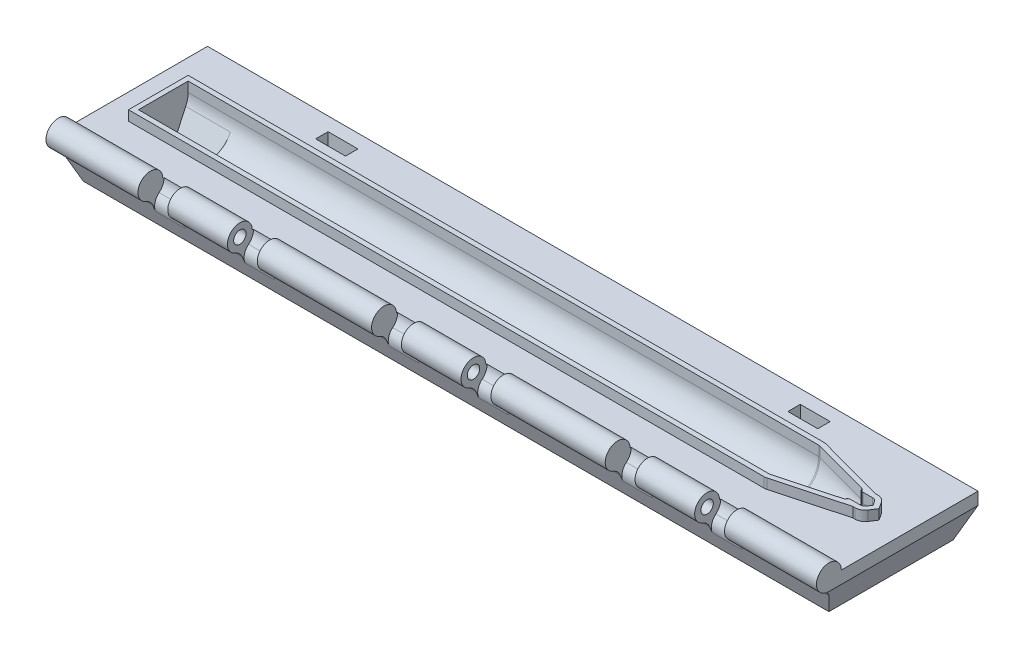
from build123d import *

# Parameters (mm, degrees)
BOSS_EXTRUDE1_START = 1.5
SKETCH1_W           = 155
SKETCH1_H           = 30
BOSS_EXTRUDE1_DEPTH = 8.5
SKETCH2_R           = 2.5
BOSS_EXTRUDE2_DEPTH = 155
CUT_EXTRUDE1_START  = 6
SKETCH3_R           = 2.75
CUT_EXTRUDE1_DEPTH  = 6
CUT_EXTRUDE2_START  = 35
SKETCH3_2_R         = 2.75
CUT_EXTRUDE2_DEPTH  = 6
CUT_EXTRUDE3_START  = 53
SKETCH3_3_R         = 2.75
CUT_EXTRUDE3_DEPTH  = 6
SKETCH4_R           = 1.25
CUT_EXTRUDE4_DEPTH  = 6
CUT_EXTRUDE5_REACH  = 134.26
SKETCH6_R           = 1.25
BOSS_EXTRUDE3_DEPTH = 2
CUT_EXTRUDE6_DEPTH  = 9
CUT_EXTRUDE7_DEPTH  = 157.484823545
FILLET4_R           = 2.5
FILLET5_R           = 2.5
CUT_EXTRUDE8_DEPTH  = 85.96322734
CUT_EXTRUDE9_START  = -44.5
CUT_EXTRUDE9_DEPTH  = 6


with BuildPart() as part:
    # Sketch1 → Boss-Extrude1 (new body)
    with BuildSketch(Plane(origin=(0, 0, 0), x_dir=(1, 0, 0), z_dir=(0, 1, 0)).offset(BOSS_EXTRUDE1_START)):
        Rectangle(SKETCH1_W, SKETCH1_H)
    extrude(amount=BOSS_EXTRUDE1_DEPTH)

    # Sketch2 → Boss-Extrude2 (add, through all)
    with BuildSketch(Plane.ZY.offset(77.5)):
        with Locations((15, 10)):
            Circle(SKETCH2_R)
    extrude(amount=-BOSS_EXTRUDE2_DEPTH)

    # Sketch3 → Cut-Extrude1 (cut)
    with BuildSketch(Plane(origin=(0, 0, 0), x_dir=(0, 0, -1), z_dir=(1, 0, 0)).offset(CUT_EXTRUDE1_START)):
        with Locations((-15, 10)):
            Circle(SKETCH3_R)
    cut_extrude1 = extrude(amount=CUT_EXTRUDE1_DEPTH, mode=Mode.SUBTRACT)

    # Mirror1: Cut-Extrude1 across plane
    add(cut_extrude1.mirror(Plane(origin=(0, 0, 0), x_dir=(0, 0, 1), z_dir=(1, 0, 0))), mode=Mode.SUBTRACT)

    # Sketch3<2> → Cut-Extrude2 (cut)
    with BuildSketch(Plane(origin=(0, 0, 0), x_dir=(0, 0, -1), z_dir=(1, 0, 0)).offset(CUT_EXTRUDE2_START)):
        with Locations((-15, 10)):
            Circle(SKETCH3_2_R)
    cut_extrude2 = extrude(amount=CUT_EXTRUDE2_DEPTH, mode=Mode.SUBTRACT)

    # Sketch3<3> → Cut-Extrude3 (cut)
    with BuildSketch(Plane(origin=(0, 0, 0), x_dir=(0, 0, -1), z_dir=(1, 0, 0)).offset(CUT_EXTRUDE3_START)):
        with Locations((-15, 10)):
            Circle(SKETCH3_3_R)
    cut_extrude3 = extrude(amount=CUT_EXTRUDE3_DEPTH, mode=Mode.SUBTRACT)

    # Mirror2: Cut-Extrude2, Cut-Extrude3 across plane
    add(cut_extrude2.mirror(Plane(origin=(0, 0, 0), x_dir=(0, 0, 1), z_dir=(1, 0, 0))), mode=Mode.SUBTRACT)
    add(cut_extrude3.mirror(Plane(origin=(0, 0, 0), x_dir=(0, 0, 1), z_dir=(1, 0, 0))), mode=Mode.SUBTRACT)

    # Sketch4 → Cut-Extrude4 (cut, symmetric)
    with BuildSketch(Plane(origin=(0, 0, 0), x_dir=(0, 0, -1), z_dir=(1, 0, 0))):
        with Locations((-15, 10)):
            Circle(SKETCH4_R)
    extrude(amount=CUT_EXTRUDE4_DEPTH, both=True, mode=Mode.SUBTRACT)

    # Sketch6 → Cut-Extrude5 (cut, up to next)
    with BuildSketch(Plane(origin=(53, 0, 0), x_dir=(0, 0, -1), z_dir=(1, 0, 0)), mode=Mode.PRIVATE) as cut_extrude5_sk1:
        with Locations((-15, 10)):
            Circle(SKETCH6_R)
    cut_extrude5_tool1 = extrude(cut_extrude5_sk1.sketch, amount=-CUT_EXTRUDE5_REACH, mode=Mode.PRIVATE) & part.part
    cut_extrude5 = cut_extrude5_tool1.solids().sort_by_distance((53, 10, 15))[0]
    add(cut_extrude5, mode=Mode.SUBTRACT)

    # Mirror3: Cut-Extrude5 across plane
    add(cut_extrude5.mirror(Plane(origin=(0, 0, 0), x_dir=(0, 0, 1), z_dir=(1, 0, 0))), mode=Mode.SUBTRACT)

    # Sketch7 → Cut-Revolve1 (revolve, cut)
    with BuildSketch(Plane(origin=(0, 10, 0), x_dir=(1, 0, 0), z_dir=(0, 1, 0))):
        with BuildLine():
            Line((-71.4, 0), (-71.4, -5))
            Line((-71.4, -5), (55.466979459, -5))
            ThreePointArc((55.466979459, -5), (55.598838528, -4.991268473), (55.728394934, -4.965226372))
            Line((55.728394934, -4.965226372), (67.230707738, -1.850016654))
            ThreePointArc((67.230707738, -1.850016654), (67.497085551, -1.671250577), (67.6, -1.367403468))
            Line((67.6, -1.367403468), (67.6, -1.75))
            ThreePointArc((67.6, -1.75), (67.746446609, -1.396446609), (68.1, -1.25))
            Line((68.1, -1.25), (70.052734234, -1.25))
            ThreePointArc((70.052734234, -1.25), (70.532810427, -1.127226794), (70.895005634, -0.789053696))
            Line((70.895005634, -0.789053696), (71.4, 0))
            Line((71.4, 0), (-71.4, 0))
        make_face()
    revolve(axis=Axis((-71.4, 10, 0), (1, 0, 0)), mode=Mode.SUBTRACT)

    # Sketch13 → Boss-Extrude3 (add)
    with BuildSketch(Plane(origin=(0, 10, 0), x_dir=(1, 0, 0), z_dir=(0, 1, 0))):
        with BuildLine():
            Line((69.579174387, 2.25), (55.98981041, 5.930452744))
            ThreePointArc((55.98981041, 5.930452744), (55.730697596, 5.982536946), (55.466979459, 6))
            Line((55.466979459, 6), (-72.4, 6))
            Line((-72.4, 6), (-72.4, -6))
            Line((-72.4, -6), (55.466979459, -6))
            ThreePointArc((55.466979459, -6), (55.730697596, -5.982536946), (55.98981041, -5.930452744))
            Line((55.98981041, -5.930452744), (69.579174387, -2.25))
            Line((69.579174387, -2.25), (70.052734234, -2.25))
            ThreePointArc((70.052734234, -2.25), (71.012886621, -2.004453588), (71.737277035, -1.328107393))
            Line((71.737277035, -1.328107393), (72.587265766, 0))
            Line((72.587265766, 0), (71.737277035, 1.328107393))
            ThreePointArc((71.737277035, 1.328107393), (71.012886621, 2.004453588), (70.052734234, 2.25))
            Line((70.052734234, 2.25), (69.579174387, 2.25))
        make_face()
        with BuildLine():
            Line((-71.4, 5), (-71.4, -5))
            Line((-71.4, -5), (55.466979459, -5))
            ThreePointArc((55.466979459, -5), (55.598838528, -4.991268473), (55.728394934, -4.965226372))
            Line((55.728394934, -4.965226372), (67.230707738, -1.850016654))
            ThreePointArc((67.230707738, -1.850016654), (67.497085551, -1.671250577), (67.6, -1.367403468))
            Line((67.6, -1.367403468), (67.6, -1.75))
            ThreePointArc((67.6, -1.75), (67.746446609, -1.396446609), (68.1, -1.25))
            Line((68.1, -1.25), (70.052734234, -1.25))
            ThreePointArc((70.052734234, -1.25), (70.532810427, -1.127226794), (70.895005634, -0.789053696))
            Line((70.895005634, -0.789053696), (71.4, 0))
            Line((71.4, 0), (70.895005634, 0.789053696))
            ThreePointArc((70.895005634, 0.789053696), (70.532810427, 1.127226794), (70.052734234, 1.25))
            Line((70.052734234, 1.25), (68.1, 1.25))
            ThreePointArc((68.1, 1.25), (67.746446609, 1.396446609), (67.6, 1.75))
            Line((67.6, 1.75), (67.6, 1.367403468))
            ThreePointArc((67.6, 1.367403468), (67.497085551, 1.671250577), (67.230707738, 1.850016654))
            Line((67.230707738, 1.850016654), (55.728394934, 4.965226372))
            ThreePointArc((55.728394934, 4.965226372), (55.598838528, 4.991268473), (55.466979459, 5))
            Line((55.466979459, 5), (-71.4, 5))
        make_face(mode=Mode.SUBTRACT)
    extrude(amount=BOSS_EXTRUDE3_DEPTH)

    # Sketch9 → Cut-Extrude6 (cut)
    with BuildSketch(Plane(origin=(-71.4, 0, 0), x_dir=(0, 0, -1), z_dir=(1, 0, 0))):
        Polygon((-1.701522254, 3), (-4.468435287, 7.756545947), (4.584879724, 8.005287511), (2.298477746, 3), align=None)
    extrude(amount=CUT_EXTRUDE6_DEPTH, mode=Mode.SUBTRACT)

    # Sketch10 → Cut-Extrude7 (cut, through all)
    with BuildSketch(Plane.ZY.offset(77.5)):
        Polygon((15, 7.5), (12.5, 1.5), (15, 1.5), align=None)
        Polygon((-15, 7.5), (-12.5, 1.5), (-15, 1.5), align=None)
    extrude(amount=-CUT_EXTRUDE7_DEPTH, mode=Mode.SUBTRACT)

    # Fillet4
    # the kernel refuses this fillet: 2.5 mm, written as the material it adds along each edge
    with BuildSketch(Plane(origin=(77.5, 7.5, 15), x_dir=(0, -0.9230769230769229, -0.3846153846153851), z_dir=(-1, 0, 0))) as fillet4_piece_1_section:
        with BuildLine():
            CenterArc((1.300319815, 2.5), FILLET4_R, 223.81306146, 46.18693854)
            ThreePointArc((-0.503686246, 0.769230769), (-0.216174948, 0.407970624), (0, 0))
            Line((0, 0), (1.300319815, 0))
        make_face()
    fillet4_piece_1 = extrude(amount=18.5, mode=Mode.PRIVATE)
    fillet4_piece_1 = fillet4_piece_1 - Plane(origin=(68.25, 10, 15), x_dir=(0, 0, -1), z_dir=(-1, 0, 0)) * Cylinder(2.75, 43, mode=Mode.PRIVATE)
    add(fillet4_piece_1)
    with BuildSketch(Plane(origin=(77.5, 7.5, 15), x_dir=(0, -0.9230769230769229, -0.3846153846153851), z_dir=(-1, 0, 0))) as fillet4_piece_2_section:
        with BuildLine():
            CenterArc((1.300319815, 2.5), FILLET4_R, 223.81306146, 46.18693854)
            ThreePointArc((-0.503686246, 0.769230769), (-0.216174948, 0.407970624), (0, 0))
            Line((0, 0), (1.300319815, 0))
        make_face()
    fillet4_piece_2 = extrude(amount=18.5, mode=Mode.PRIVATE)
    fillet4_piece_2 = fillet4_piece_2 & Plane(origin=(68.25, 10, 15), x_dir=(0, 0, -1), z_dir=(-1, 0, 0)) * Cylinder(2.75, 43, mode=Mode.PRIVATE)
    add(fillet4_piece_2)
    with BuildSketch(Plane(origin=(77.5, 7.5, 15), x_dir=(0, -0.9230769230769229, -0.3846153846153851), z_dir=(-1, 0, 0))) as fillet4_piece_3_section:
        with BuildLine():
            CenterArc((1.300319815, 2.5), FILLET4_R, 223.81306146, 46.18693854)
            ThreePointArc((-0.503686246, 0.769230769), (-0.216174948, 0.407970624), (0, 0))
            Line((0, 0), (1.300319815, 0))
        make_face()
    fillet4_piece_3 = extrude(amount=21.750799538, mode=Mode.PRIVATE)
    fillet4_piece_3 = split(fillet4_piece_3, bisect_by=Plane(origin=(59, 6.935167345, 14.810535734), z_dir=(-1, 0, 0)), keep=Keep.TOP, mode=Mode.PRIVATE)
    fillet4_piece_3 = fillet4_piece_3 - Plane(origin=(57.374600231, 10, 15), x_dir=(0, 0, -1), z_dir=(-1, 0, 0)) * Cylinder(2.75, 49, mode=Mode.PRIVATE)
    add(fillet4_piece_3)
    with BuildSketch(Plane(origin=(9.250799538, 7.5, 15), x_dir=(0, -0.923076923076923, -0.3846153846153848), z_dir=(-1, 0, 0))) as fillet4_piece_4_section:
        with BuildLine():
            CenterArc((1.300319815, 2.5), FILLET4_R, 223.81306146, 46.18693854)
            ThreePointArc((-0.503686246, 0.769230769), (-0.216174948, 0.407970624), (0, 0))
            Line((0, 0), (1.300319815, 0))
        make_face()
    fillet4_piece_4 = extrude(amount=15.250799538, mode=Mode.PRIVATE)
    fillet4_piece_4 = fillet4_piece_4 - Plane(origin=(7.625399769, 10, 15), x_dir=(0, 0, -1), z_dir=(-1, 0, 0)) * Cylinder(2.75, 36, mode=Mode.PRIVATE)
    fillet4_piece_4 = split(fillet4_piece_4, bisect_by=Plane(origin=(6, 6.935167345, 14.810535734), z_dir=(1, 0, 0)), keep=Keep.TOP, mode=Mode.PRIVATE)
    add(fillet4_piece_4)
    with BuildSketch(Plane(origin=(6, 7.5, 15), x_dir=(0, -0.9230769230769229, -0.3846153846153851), z_dir=(-1, 0, 0))) as fillet4_piece_5_section:
        with BuildLine():
            CenterArc((1.300319815, 2.5), FILLET4_R, 223.81306146, 46.18693854)
            ThreePointArc((-0.503686246, 0.769230769), (-0.216174948, 0.407970624), (0, 0))
            Line((0, 0), (1.300319815, 0))
        make_face()
    fillet4_piece_5 = extrude(amount=12, mode=Mode.PRIVATE)
    fillet4_piece_5 = fillet4_piece_5 - Plane(origin=(0, 10, 15), x_dir=(0, 0, -1), z_dir=(-1, 0, 0)) * Cylinder(2.75, 30, mode=Mode.PRIVATE)
    add(fillet4_piece_5)
    with BuildSketch(Plane(origin=(6, 7.5, 15), x_dir=(0, -0.9230769230769229, -0.3846153846153851), z_dir=(-1, 0, 0))) as fillet4_piece_6_section:
        with BuildLine():
            CenterArc((1.300319815, 2.5), FILLET4_R, 223.81306146, 46.18693854)
            ThreePointArc((-0.503686246, 0.769230769), (-0.216174948, 0.407970624), (0, 0))
            Line((0, 0), (1.300319815, 0))
        make_face()
    fillet4_piece_6 = extrude(amount=12, mode=Mode.PRIVATE)
    fillet4_piece_6 = fillet4_piece_6 & Plane(origin=(0, 10, 15), x_dir=(0, 0, -1), z_dir=(-1, 0, 0)) * Cylinder(2.75, 30, mode=Mode.PRIVATE)
    add(fillet4_piece_6)
    with BuildSketch(Plane(origin=(6, 7.5, 15), x_dir=(0, -0.9230769230769229, -0.3846153846153851), z_dir=(-1, 0, 0))) as fillet4_piece_7_section:
        with BuildLine():
            CenterArc((1.300319815, 2.5), FILLET4_R, 223.81306146, 46.18693854)
            ThreePointArc((-0.503686246, 0.769230769), (-0.216174948, 0.407970624), (0, 0))
            Line((0, 0), (1.300319815, 0))
        make_face()
    fillet4_piece_7 = extrude(amount=15.250799538, mode=Mode.PRIVATE)
    fillet4_piece_7 = fillet4_piece_7 - Plane(origin=(-7.625399769, 10, 15), x_dir=(0, 0, -1), z_dir=(-1, 0, 0)) * Cylinder(2.75, 36, mode=Mode.PRIVATE)
    fillet4_piece_7 = split(fillet4_piece_7, bisect_by=Plane(origin=(-6, 6.935167345, 14.810535734), z_dir=(-1, 0, 0)), keep=Keep.TOP, mode=Mode.PRIVATE)
    add(fillet4_piece_7)
    with BuildSketch(Plane(origin=(-8.749200462, 7.5, 15), x_dir=(0, -0.9230769230769229, -0.3846153846153851), z_dir=(-1, 0, 0))) as fillet4_piece_8_section:
        with BuildLine():
            CenterArc((1.300319815, 2.5), FILLET4_R, 223.81306146, 46.18693854)
            ThreePointArc((-0.503686246, 0.769230769), (-0.216174948, 0.407970624), (0, 0))
            Line((0, 0), (1.300319815, 0))
        make_face()
    fillet4_piece_8 = extrude(amount=26.250799538, mode=Mode.PRIVATE)
    fillet4_piece_8 = fillet4_piece_8 - Plane(origin=(-10.374600231, 10, 15), x_dir=(0, 0, -1), z_dir=(1, 0, 0)) * Cylinder(2.75, 58, mode=Mode.PRIVATE)
    fillet4_piece_8 = split(fillet4_piece_8, bisect_by=Plane(origin=(-12, 6.935167345, 14.810535734), z_dir=(1, 0, 0)), keep=Keep.TOP, mode=Mode.PRIVATE)
    add(fillet4_piece_8)
    with BuildSketch(Plane(origin=(-12, 7.5, 15), x_dir=(0, -0.9230769230769229, -0.3846153846153851), z_dir=(-1, 0, 0))) as fillet4_piece_9_section:
        with BuildLine():
            CenterArc((1.300319815, 2.5), FILLET4_R, 223.81306146, 46.18693854)
            ThreePointArc((-0.503686246, 0.769230769), (-0.216174948, 0.407970624), (0, 0))
            Line((0, 0), (1.300319815, 0))
        make_face()
    fillet4_piece_9 = extrude(amount=23, mode=Mode.PRIVATE)
    fillet4_piece_9 = fillet4_piece_9 - Plane(origin=(-23.5, 10, 15), x_dir=(0, 0, -1), z_dir=(1, 0, 0)) * Cylinder(2.75, 52, mode=Mode.PRIVATE)
    add(fillet4_piece_9)
    with BuildSketch(Plane(origin=(-12, 7.5, 15), x_dir=(0, -0.9230769230769229, -0.3846153846153851), z_dir=(-1, 0, 0))) as fillet4_piece_10_section:
        with BuildLine():
            CenterArc((1.300319815, 2.5), FILLET4_R, 223.81306146, 46.18693854)
            ThreePointArc((-0.503686246, 0.769230769), (-0.216174948, 0.407970624), (0, 0))
            Line((0, 0), (1.300319815, 0))
        make_face()
    fillet4_piece_10 = extrude(amount=23, mode=Mode.PRIVATE)
    fillet4_piece_10 = fillet4_piece_10 & Plane(origin=(-23.5, 10, 15), x_dir=(0, 0, -1), z_dir=(1, 0, 0)) * Cylinder(2.75, 52, mode=Mode.PRIVATE)
    add(fillet4_piece_10)
    with BuildSketch(Plane(origin=(-12, 7.5, 15), x_dir=(0, -0.9230769230769229, -0.3846153846153851), z_dir=(-1, 0, 0))) as fillet4_piece_11_section:
        with BuildLine():
            CenterArc((1.300319815, 2.5), FILLET4_R, 223.81306146, 46.18693854)
            ThreePointArc((-0.503686246, 0.769230769), (-0.216174948, 0.407970624), (0, 0))
            Line((0, 0), (1.300319815, 0))
        make_face()
    fillet4_piece_11 = extrude(amount=26.250799538, mode=Mode.PRIVATE)
    fillet4_piece_11 = fillet4_piece_11 - Plane(origin=(-36.625399769, 10, 15), x_dir=(0, 0, -1), z_dir=(1, 0, 0)) * Cylinder(2.75, 58, mode=Mode.PRIVATE)
    fillet4_piece_11 = split(fillet4_piece_11, bisect_by=Plane(origin=(-35, 6.935167345, 14.810535734), z_dir=(-1, 0, 0)), keep=Keep.TOP, mode=Mode.PRIVATE)
    add(fillet4_piece_11)
    with BuildSketch(Plane(origin=(38.250799538, 7.5, 15), x_dir=(0, -0.9230769230769229, -0.3846153846153851), z_dir=(-1, 0, 0))) as fillet4_piece_12_section:
        with BuildLine():
            CenterArc((1.300319815, 2.5), FILLET4_R, 223.81306146, 46.18693854)
            ThreePointArc((-0.503686246, 0.769230769), (-0.216174948, 0.407970624), (0, 0))
            Line((0, 0), (1.300319815, 0))
        make_face()
    fillet4_piece_12 = extrude(amount=26.250799538, mode=Mode.PRIVATE)
    fillet4_piece_12 = fillet4_piece_12 - Plane(origin=(36.625399769, 10, 15), x_dir=(0, 0, -1), z_dir=(-1, 0, 0)) * Cylinder(2.75, 58, mode=Mode.PRIVATE)
    fillet4_piece_12 = split(fillet4_piece_12, bisect_by=Plane(origin=(35, 6.935167345, 14.810535734), z_dir=(1, 0, 0)), keep=Keep.TOP, mode=Mode.PRIVATE)
    add(fillet4_piece_12)
    with BuildSketch(Plane(origin=(35, 7.5, 15), x_dir=(0, -0.9230769230769229, -0.3846153846153851), z_dir=(-1, 0, 0))) as fillet4_piece_13_section:
        with BuildLine():
            CenterArc((1.300319815, 2.5), FILLET4_R, 223.81306146, 46.18693854)
            ThreePointArc((-0.503686246, 0.769230769), (-0.216174948, 0.407970624), (0, 0))
            Line((0, 0), (1.300319815, 0))
        make_face()
    fillet4_piece_13 = extrude(amount=23, mode=Mode.PRIVATE)
    fillet4_piece_13 = fillet4_piece_13 - Plane(origin=(23.5, 10, 15), x_dir=(0, 0, -1), z_dir=(-1, 0, 0)) * Cylinder(2.75, 52, mode=Mode.PRIVATE)
    add(fillet4_piece_13)
    with BuildSketch(Plane(origin=(35, 7.5, 15), x_dir=(0, -0.9230769230769229, -0.3846153846153851), z_dir=(-1, 0, 0))) as fillet4_piece_14_section:
        with BuildLine():
            CenterArc((1.300319815, 2.5), FILLET4_R, 223.81306146, 46.18693854)
            ThreePointArc((-0.503686246, 0.769230769), (-0.216174948, 0.407970624), (0, 0))
            Line((0, 0), (1.300319815, 0))
        make_face()
    fillet4_piece_14 = extrude(amount=23, mode=Mode.PRIVATE)
    fillet4_piece_14 = fillet4_piece_14 & Plane(origin=(23.5, 10, 15), x_dir=(0, 0, -1), z_dir=(-1, 0, 0)) * Cylinder(2.75, 52, mode=Mode.PRIVATE)
    add(fillet4_piece_14)
    with BuildSketch(Plane(origin=(35, 7.5, 15), x_dir=(0, -0.9230769230769229, -0.3846153846153851), z_dir=(-1, 0, 0))) as fillet4_piece_15_section:
        with BuildLine():
            CenterArc((1.300319815, 2.5), FILLET4_R, 223.81306146, 46.18693854)
            ThreePointArc((-0.503686246, 0.769230769), (-0.216174948, 0.407970624), (0, 0))
            Line((0, 0), (1.300319815, 0))
        make_face()
    fillet4_piece_15 = extrude(amount=26.250799538, mode=Mode.PRIVATE)
    fillet4_piece_15 = fillet4_piece_15 - Plane(origin=(10.374600231, 10, 15), x_dir=(0, 0, -1), z_dir=(-1, 0, 0)) * Cylinder(2.75, 58, mode=Mode.PRIVATE)
    fillet4_piece_15 = split(fillet4_piece_15, bisect_by=Plane(origin=(12, 6.935167345, 14.810535734), z_dir=(-1, 0, 0)), keep=Keep.TOP, mode=Mode.PRIVATE)
    add(fillet4_piece_15)
    with BuildSketch(Plane(origin=(56.250799538, 7.5, 15), x_dir=(0, -0.9230769230769229, -0.3846153846153851), z_dir=(-1, 0, 0))) as fillet4_piece_16_section:
        with BuildLine():
            CenterArc((1.300319815, 2.5), FILLET4_R, 223.81306146, 46.18693854)
            ThreePointArc((-0.503686246, 0.769230769), (-0.216174948, 0.407970624), (0, 0))
            Line((0, 0), (1.300319815, 0))
        make_face()
    fillet4_piece_16 = extrude(amount=15.250799538, mode=Mode.PRIVATE)
    fillet4_piece_16 = fillet4_piece_16 - Plane(origin=(54.625399769, 10, 15), x_dir=(0, 0, -1), z_dir=(-1, 0, 0)) * Cylinder(2.75, 36, mode=Mode.PRIVATE)
    fillet4_piece_16 = split(fillet4_piece_16, bisect_by=Plane(origin=(53, 6.935167345, 14.810535734), z_dir=(1, 0, 0)), keep=Keep.TOP, mode=Mode.PRIVATE)
    add(fillet4_piece_16)
    with BuildSketch(Plane(origin=(53, 7.5, 15), x_dir=(0, -0.9230769230769229, -0.3846153846153851), z_dir=(-1, 0, 0))) as fillet4_piece_17_section:
        with BuildLine():
            CenterArc((1.300319815, 2.5), FILLET4_R, 223.81306146, 46.18693854)
            ThreePointArc((-0.503686246, 0.769230769), (-0.216174948, 0.407970624), (0, 0))
            Line((0, 0), (1.300319815, 0))
        make_face()
    fillet4_piece_17 = extrude(amount=12, mode=Mode.PRIVATE)
    fillet4_piece_17 = fillet4_piece_17 - Plane(origin=(47, 10, 15), x_dir=(0, 0, -1), z_dir=(-1, 0, 0)) * Cylinder(2.75, 30, mode=Mode.PRIVATE)
    add(fillet4_piece_17)
    with BuildSketch(Plane(origin=(53, 7.5, 15), x_dir=(0, -0.9230769230769229, -0.3846153846153851), z_dir=(-1, 0, 0))) as fillet4_piece_18_section:
        with BuildLine():
            CenterArc((1.300319815, 2.5), FILLET4_R, 223.81306146, 46.18693854)
            ThreePointArc((-0.503686246, 0.769230769), (-0.216174948, 0.407970624), (0, 0))
            Line((0, 0), (1.300319815, 0))
        make_face()
    fillet4_piece_18 = extrude(amount=12, mode=Mode.PRIVATE)
    fillet4_piece_18 = fillet4_piece_18 & Plane(origin=(47, 10, 15), x_dir=(0, 0, -1), z_dir=(-1, 0, 0)) * Cylinder(2.75, 30, mode=Mode.PRIVATE)
    add(fillet4_piece_18)
    with BuildSketch(Plane(origin=(53, 7.5, 15), x_dir=(0, -0.9230769230769229, -0.3846153846153851), z_dir=(-1, 0, 0))) as fillet4_piece_19_section:
        with BuildLine():
            CenterArc((1.300319815, 2.5), FILLET4_R, 223.81306146, 46.18693854)
            ThreePointArc((-0.503686246, 0.769230769), (-0.216174948, 0.407970624), (0, 0))
            Line((0, 0), (1.300319815, 0))
        make_face()
    fillet4_piece_19 = extrude(amount=15.250799538, mode=Mode.PRIVATE)
    fillet4_piece_19 = fillet4_piece_19 - Plane(origin=(39.374600231, 10, 15), x_dir=(0, 0, -1), z_dir=(-1, 0, 0)) * Cylinder(2.75, 36, mode=Mode.PRIVATE)
    fillet4_piece_19 = split(fillet4_piece_19, bisect_by=Plane(origin=(41, 6.935167345, 14.810535734), z_dir=(-1, 0, 0)), keep=Keep.TOP, mode=Mode.PRIVATE)
    add(fillet4_piece_19)
    with BuildSketch(Plane(origin=(-37.749200462, 7.5, 15), x_dir=(0, -0.9230769230769229, -0.3846153846153851), z_dir=(-1, 0, 0))) as fillet4_piece_20_section:
        with BuildLine():
            CenterArc((1.300319815, 2.5), FILLET4_R, 223.81306146, 46.18693854)
            ThreePointArc((-0.503686246, 0.769230769), (-0.216174948, 0.407970624), (0, 0))
            Line((0, 0), (1.300319815, 0))
        make_face()
    fillet4_piece_20 = extrude(amount=15.250799538, mode=Mode.PRIVATE)
    fillet4_piece_20 = fillet4_piece_20 - Plane(origin=(-39.374600231, 10, 15), x_dir=(0, 0, -1), z_dir=(1, 0, 0)) * Cylinder(2.75, 36, mode=Mode.PRIVATE)
    fillet4_piece_20 = split(fillet4_piece_20, bisect_by=Plane(origin=(-41, 6.935167345, 14.810535734), z_dir=(1, 0, 0)), keep=Keep.TOP, mode=Mode.PRIVATE)
    add(fillet4_piece_20)
    with BuildSketch(Plane(origin=(-41, 7.5, 15), x_dir=(0, -0.9230769230769229, -0.3846153846153851), z_dir=(-1, 0, 0))) as fillet4_piece_21_section:
        with BuildLine():
            CenterArc((1.300319815, 2.5), FILLET4_R, 223.81306146, 46.18693854)
            ThreePointArc((-0.503686246, 0.769230769), (-0.216174948, 0.407970624), (0, 0))
            Line((0, 0), (1.300319815, 0))
        make_face()
    fillet4_piece_21 = extrude(amount=12, mode=Mode.PRIVATE)
    fillet4_piece_21 = fillet4_piece_21 - Plane(origin=(-47, 10, 15), x_dir=(0, 0, -1), z_dir=(1, 0, 0)) * Cylinder(2.75, 30, mode=Mode.PRIVATE)
    add(fillet4_piece_21)
    with BuildSketch(Plane(origin=(-41, 7.5, 15), x_dir=(0, -0.9230769230769229, -0.3846153846153851), z_dir=(-1, 0, 0))) as fillet4_piece_22_section:
        with BuildLine():
            CenterArc((1.300319815, 2.5), FILLET4_R, 223.81306146, 46.18693854)
            ThreePointArc((-0.503686246, 0.769230769), (-0.216174948, 0.407970624), (0, 0))
            Line((0, 0), (1.300319815, 0))
        make_face()
    fillet4_piece_22 = extrude(amount=12, mode=Mode.PRIVATE)
    fillet4_piece_22 = fillet4_piece_22 & Plane(origin=(-47, 10, 15), x_dir=(0, 0, -1), z_dir=(1, 0, 0)) * Cylinder(2.75, 30, mode=Mode.PRIVATE)
    add(fillet4_piece_22)
    with BuildSketch(Plane(origin=(-41, 7.5, 15), x_dir=(0, -0.9230769230769229, -0.3846153846153851), z_dir=(-1, 0, 0))) as fillet4_piece_23_section:
        with BuildLine():
            CenterArc((1.300319815, 2.5), FILLET4_R, 223.81306146, 46.18693854)
            ThreePointArc((-0.503686246, 0.769230769), (-0.216174948, 0.407970624), (0, 0))
            Line((0, 0), (1.300319815, 0))
        make_face()
    fillet4_piece_23 = extrude(amount=15.250799538, mode=Mode.PRIVATE)
    fillet4_piece_23 = fillet4_piece_23 - Plane(origin=(-54.625399769, 10, 15), x_dir=(0, 0, -1), z_dir=(1, 0, 0)) * Cylinder(2.75, 36, mode=Mode.PRIVATE)
    fillet4_piece_23 = split(fillet4_piece_23, bisect_by=Plane(origin=(-53, 6.935167345, 14.810535734), z_dir=(-1, 0, 0)), keep=Keep.TOP, mode=Mode.PRIVATE)
    add(fillet4_piece_23)
    with BuildSketch(Plane(origin=(-55.749200462, 7.5, 15), x_dir=(0, 0.1838929918147279, 0.9829462689086461), z_dir=(-1, 0, 0))) as fillet4_piece_24_section:
        with BuildLine():
            CenterArc((1.379197439, -2.457365672), FILLET4_R, 100.596598256, 46.18693854)
            Line((-0.712319921, -1.087856586), (0, 0))
            ThreePointArc((0, 0), (0.45973248, -0.042634328), (0.919464959, 0))
        make_face()
    fillet4_piece_24 = extrude(amount=21.750799538, mode=Mode.PRIVATE)
    fillet4_piece_24 = split(fillet4_piece_24, bisect_by=Plane(origin=(-59, 6.935167345, 14.810535734), z_dir=(1, 0, 0)), keep=Keep.TOP, mode=Mode.PRIVATE)
    fillet4_piece_24 = fillet4_piece_24 - Plane(origin=(-57.374600231, 10, 15), x_dir=(0, 0, -1), z_dir=(1, 0, 0)) * Cylinder(2.75, 48, mode=Mode.PRIVATE)
    add(fillet4_piece_24)
    with BuildSketch(Plane(origin=(-59, 7.5, 15), x_dir=(0, 0.1838929918147279, 0.9829462689086461), z_dir=(-1, 0, 0))) as fillet4_piece_25_section:
        with BuildLine():
            CenterArc((1.379197439, -2.457365672), FILLET4_R, 100.596598256, 46.18693854)
            Line((-0.712319921, -1.087856586), (0, 0))
            ThreePointArc((0, 0), (0.45973248, -0.042634328), (0.919464959, 0))
        make_face()
    fillet4_piece_25 = extrude(amount=18.5, mode=Mode.PRIVATE)
    fillet4_piece_25 = fillet4_piece_25 & Plane(origin=(-68.25, 10, 15), x_dir=(0, 0, -1), z_dir=(1, 0, 0)) * Cylinder(2.75, 42, mode=Mode.PRIVATE)
    add(fillet4_piece_25)
    with BuildSketch(Plane(origin=(-59, 7.5, 15), x_dir=(0, 0.1838929918147279, 0.9829462689086461), z_dir=(-1, 0, 0))) as fillet4_piece_26_section:
        with BuildLine():
            CenterArc((1.379197439, -2.457365672), FILLET4_R, 100.596598256, 46.18693854)
            Line((-0.712319921, -1.087856586), (0, 0))
            ThreePointArc((0, 0), (0.45973248, -0.042634328), (0.919464959, 0))
        make_face()
    fillet4_piece_26 = extrude(amount=18.5, mode=Mode.PRIVATE)
    fillet4_piece_26 = fillet4_piece_26 - Plane(origin=(-68.25, 10, 15), x_dir=(0, 0, -1), z_dir=(1, 0, 0)) * Cylinder(2.75, 42, mode=Mode.PRIVATE)
    add(fillet4_piece_26)

    # Fillet5
    # the kernel refuses this fillet: 2.5 mm, written as the material it takes off along each edge
    with BuildSketch(Plane(origin=(-53, 7.257719675, 15.205909246), x_dir=(-1.5067847273280937e-15, -0.8753317505424749, -0.48352282933926355), z_dir=(-1, 0, 0)), Plane(origin=(-35, 7.257719675, 15.205909246), x_dir=(0, -0.8753317505424749, -0.4835228293392634), z_dir=(-1, 0, 0)), Plane(origin=(-6, 7.257719675, 15.205909246), x_dir=(0, -0.8753317505424749, -0.4835228293392634), z_dir=(-1, 0, 0)), Plane(origin=(12, 7.257719675, 15.205909246), x_dir=(-1.2204816990271069e-15, -0.8753317505424749, -0.48352282933926355), z_dir=(-1, 0, 0)), Plane(origin=(41, 7.257719675, 15.205909246), x_dir=(-1.2204816990271069e-15, -0.8753317505424749, -0.48352282933926355), z_dir=(-1, 0, 0)), Plane(origin=(59, 7.257719675, 15.205909246), x_dir=(0, -0.8753317505424744, -0.48352282933926427), z_dir=(-1, 0, 0))) as fillet5_piece_1:
        with BuildLine():
            CenterArc((2.857120655, -2.484922145), FILLET5_R, 96.295872515, 72.959938099)
            Line((0.400947383, -2.018861144), (0.155330056, -1.972255043))
            ThreePointArc((0.155330056, -1.972255043), (0.151266072, -1.019203243), (-0.209167565, -0.136926731))
            Line((-0.209167565, -0.136926731), (0.090580679, 0.233013177))
            ThreePointArc((0.090580679, 0.233013177), (1.152547885, 0.093701837), (2.555548209, 0.248492214))
            Line((2.555548209, 0.248492214), (2.582963886, 0))
        make_face()
    extrude(amount=6, mode=Mode.SUBTRACT)

    # Sketch11 → Cut-Extrude8 (cut, through all)
    with BuildSketch(Plane(origin=(0, 0, -15), x_dir=(-1, 0, 0), z_dir=(0, 0, -1))):
        Polygon((77.5, 7.5), (75, 1.5), (77.5, 1.5), align=None)
    cut_extrude8 = extrude(amount=-CUT_EXTRUDE8_DEPTH, mode=Mode.SUBTRACT)

    # Mirror4: Cut-Extrude8 across plane
    add(cut_extrude8.mirror(Plane(origin=(0, 0, 0), x_dir=(0, 0, 1), z_dir=(1, 0, 0))), mode=Mode.SUBTRACT)

    # Sketch14 → Cut-Extrude9 (cut)
    with BuildSketch(Plane(origin=(0, 0, -4.38802576), x_dir=(0, 0, -1), z_dir=(-1, 0, 0)).offset(CUT_EXTRUDE9_START)):
        with BuildLine():
            Line((5.36197424, -10), (7.86197424, -10))
            Line((7.86197424, -10), (7.86197424, -7.144151844))
            ThreePointArc((7.86197424, -7.144151844), (7.928927101, -7.029146511), (8.039036778, -6.954415184))
            Line((8.039036778, -6.954415184), (8.56197424, -6.75))
            Line((8.56197424, -6.75), (7.86197424, -4.75))
            Line((7.86197424, -4.75), (5.36197424, -4.75))
            Line((5.36197424, -4.75), (5.36197424, -10))
        make_face()
    cut_extrude9 = extrude(amount=-CUT_EXTRUDE9_DEPTH, mode=Mode.SUBTRACT)

    # Mirror5: Cut-Extrude9 across plane
    add(cut_extrude9.mirror(Plane(origin=(0, 0, 0), x_dir=(0, 0, 1), z_dir=(1, 0, 0))), mode=Mode.SUBTRACT)


solid = part.part
